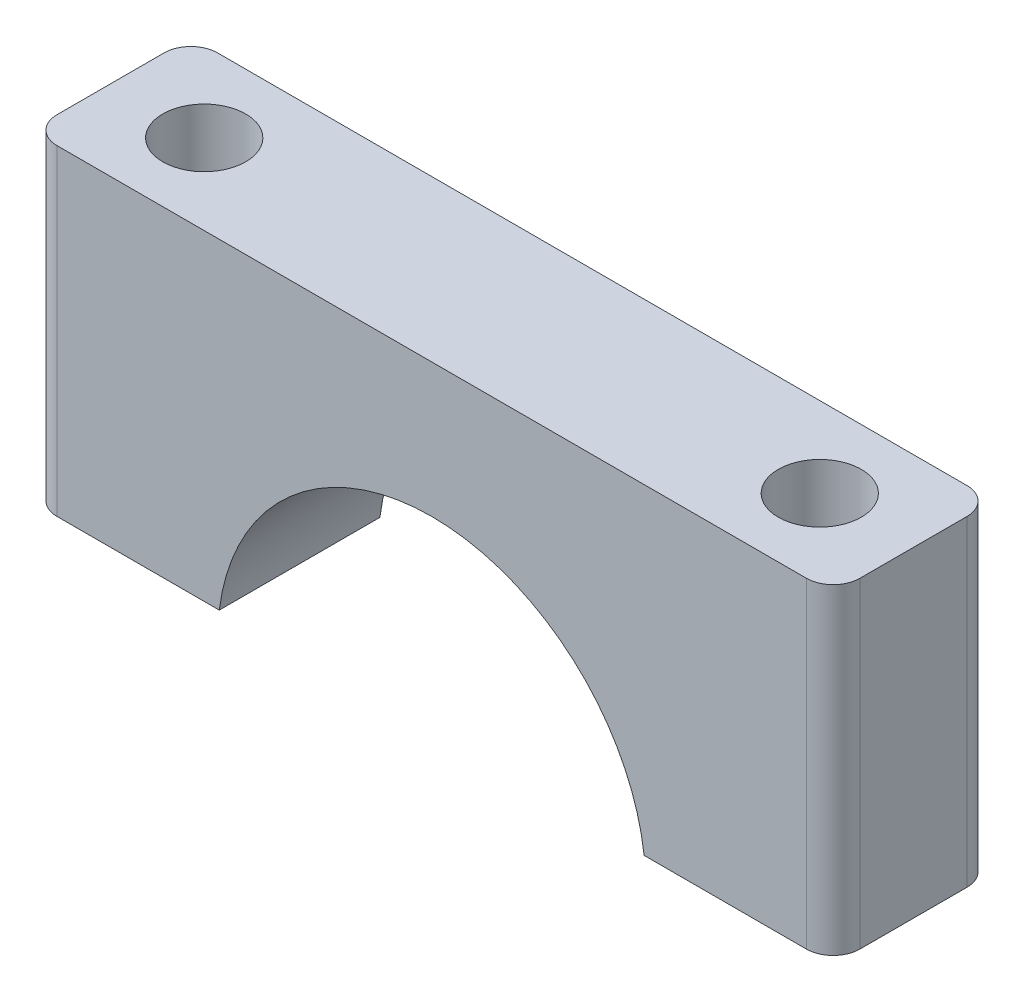
from build123d import *

# Parameters (mm, degrees)
SKETCH1_W           = 30
SKETCH1_H           = 12
BOSS_EXTRUDE1_DEPTH = 6
SKETCH2_R           = 8
CUT_EXTRUDE1_DEPTH  = 18.23368794
SKETCH3_R           = 1.55
CUT_EXTRUDE2_DEPTH  = 21.124611797
FILLET1_R           = 1


with BuildPart() as part:
    # Sketch1 → Boss-Extrude1 (new body)
    with BuildSketch(Plane.XY):
        Rectangle(SKETCH1_W, SKETCH1_H)
    extrude(amount=BOSS_EXTRUDE1_DEPTH)

    # Sketch2 → Cut-Extrude1 (cut, through all)
    with BuildSketch(Plane.XY.offset(6)):
        with Locations((0, -7)):
            Circle(SKETCH2_R)
    extrude(amount=-CUT_EXTRUDE1_DEPTH, mode=Mode.SUBTRACT)

    # Sketch3 → Cut-Extrude2 (cut, through all)
    with BuildSketch(Plane(origin=(0, 6, 0), x_dir=(1, 0, 0), z_dir=(0, 1, 0))):
        with Locations((-11.5, -3)):
            Circle(SKETCH3_R)
        with Locations((11.5, -3)):
            Circle(SKETCH3_R)
    extrude(amount=-CUT_EXTRUDE2_DEPTH, mode=Mode.SUBTRACT)

    # Fillet1
    fillet1_edges = [part.edges().sort_by_distance(p)[0] for p in [
        (15, 0, 0),
        (15, 0, 6),
        (-15, 0, 0),
        (-15, 0, 6),
    ]]
    fillet(fillet1_edges, radius=FILLET1_R)


solid = part.part
